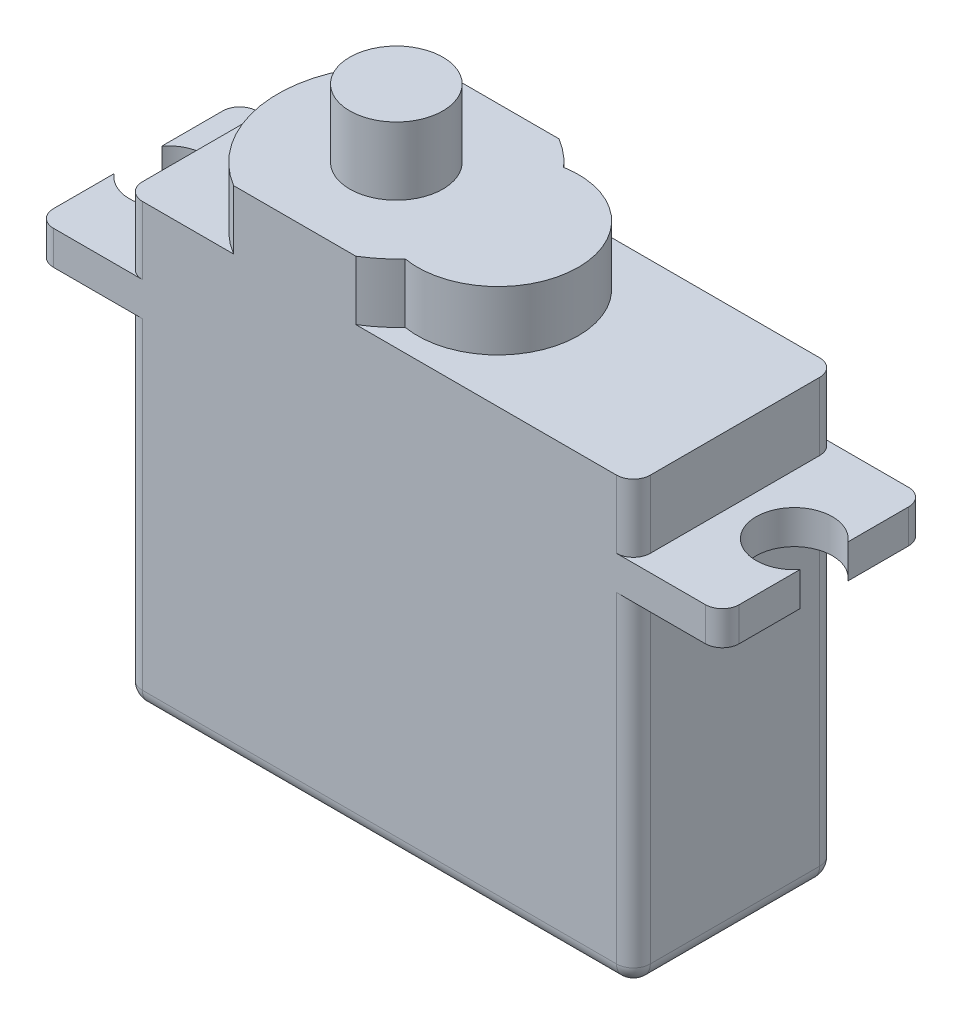
from build123d import *

# Parameters (mm, degrees)
SKETCH1_W           = 30
SKETCH1_H           = 12
BOSS_EXTRUDE1_DEPTH = 20
BOSS_EXTRUDE2_DEPTH = 2
SKETCH3_W           = 30
SKETCH3_H           = 12
BOSS_EXTRUDE3_DEPTH = 4
BOSS_EXTRUDE4_DEPTH = 3.5
SKETCH5_R           = 2.75
BOSS_EXTRUDE5_DEPTH = 4
FILLET1_R           = 1


with BuildPart() as part:
    # Sketch1 → Boss-Extrude1 (new body)
    with BuildSketch(Plane(origin=(0, 0, 0), x_dir=(1, 0, 0), z_dir=(0, 1, 0))):
        Rectangle(SKETCH1_W, SKETCH1_H)
    extrude(amount=BOSS_EXTRUDE1_DEPTH)

    # Sketch2 → Boss-Extrude2 (add)
    with BuildSketch(Plane(origin=(0, 20, 0), x_dir=(1, 0, 0), z_dir=(0, 1, 0))):
        with BuildLine():
            Line((-20.25, 6), (20.25, 6))
            Line((20.25, 6), (20.25, 1.414213562))
            ThreePointArc((20.25, 1.414213562), (16.25, 0), (20.25, -1.414213562))
            Line((20.25, -1.414213562), (20.25, -6))
            Line((20.25, -6), (-20.25, -6))
            Line((-20.25, -6), (-20.25, -1.414213562))
            ThreePointArc((-20.25, -1.414213562), (-16.25, 0), (-20.25, 1.414213562))
            Line((-20.25, 1.414213562), (-20.25, 6))
        make_face()
    extrude(amount=BOSS_EXTRUDE2_DEPTH)

    # Sketch3 → Boss-Extrude3 (add)
    with BuildSketch(Plane(origin=(0, 22, 0), x_dir=(1, 0, 0), z_dir=(0, 1, 0))):
        Rectangle(SKETCH3_W, SKETCH3_H)
    extrude(amount=BOSS_EXTRUDE3_DEPTH)

    # Sketch4 → Boss-Extrude4 (add)
    with BuildSketch(Plane(origin=(0, 26, 0), x_dir=(1, 0, 0), z_dir=(0, 1, 0))):
        with BuildLine():
            Line((-8.605551275, 6), (-1.394448725, 6))
            ThreePointArc((-1.394448725, 6), (-0.546683534, 5.400738139), (0.203125, 4.682679813))
            ThreePointArc((0.203125, 4.682679813), (5.75, 0), (0.203125, -4.682679813))
            ThreePointArc((0.203125, -4.682679813), (-0.546683534, -5.400738139), (-1.394448725, -6))
            Line((-1.394448725, -6), (-8.605551275, -6))
            ThreePointArc((-8.605551275, -6), (-12, 0), (-8.605551275, 6))
        make_face()
    extrude(amount=BOSS_EXTRUDE4_DEPTH)

    # Sketch5 → Boss-Extrude5 (add)
    with BuildSketch(Plane(origin=(0, 29.5, 0), x_dir=(1, 0, 0), z_dir=(0, 1, 0))):
        with Locations((-5, 0)):
            Circle(SKETCH5_R)
    extrude(amount=BOSS_EXTRUDE5_DEPTH)

    # Fillet1
    fillet1_edges = [part.edges().sort_by_distance(p)[0] for p in [
        (-15, 0, 0),
        (0, 0, -6),
        (15, 0, 0),
        (0, 0, 6),
        (15, 24, -6),
        (15, 24, 6),
        (-15, 24, 6),
        (-15, 24, -6),
        (20.25, 21, 6),
        (20.25, 21, -6),
        (-20.25, 21, -6),
        (-20.25, 21, 6),
        (-15, 10, -6),
        (15, 10, -6),
        (15, 10, 6),
        (-15, 10, 6),
    ]]
    fillet(fillet1_edges, radius=FILLET1_R)


solid = part.part
